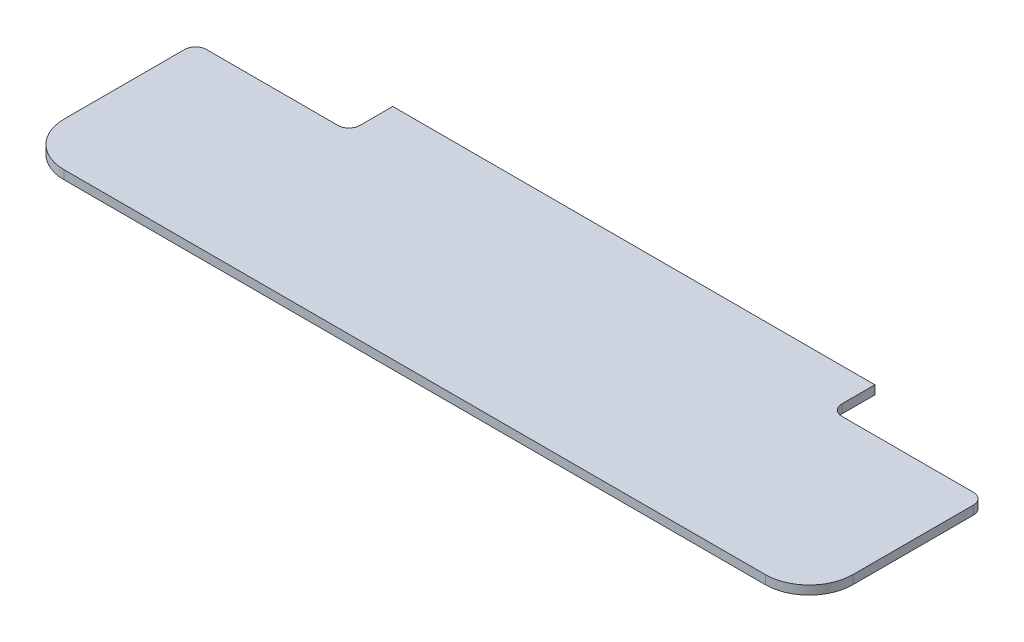
from build123d import *

# Parameters (mm, degrees)
SKETCH_1_W          = 360
SKETCH_1_H          = 100
EXTRUDE_1_DEPTH     = 4
FILLET_3_R          = 20
SKETCH_4_W          = 70
SKETCH_4_H          = 20
CUT_EXTRUDE_2_DEPTH = 6
FILLET_5_R          = 5


with BuildPart() as part:
    # 草图1 → 凸台-拉伸1 (new body)
    with BuildSketch(Plane(origin=(0, 0, 0), x_dir=(1, 0, 0), z_dir=(0, 1, 0))):
        Rectangle(SKETCH_1_W, SKETCH_1_H)
    extrude(amount=EXTRUDE_1_DEPTH)

    # 圆角3
    fillet_3_edges = [part.edges().sort_by_distance(p)[0] for p in [
        (-180, 2, 50),
        (180, 2, 50),
    ]]
    fillet(fillet_3_edges, radius=FILLET_3_R)

    # 草图4 → 切除-拉伸2 (cut)
    with BuildSketch(Plane(origin=(0, 4, 0), x_dir=(1, 0, 0), z_dir=(0, 1, 0))):
        with Locations((-145, 40)):
            Rectangle(SKETCH_4_W, SKETCH_4_H)
        with Locations((145, 40)):
            Rectangle(SKETCH_4_W, SKETCH_4_H)
    extrude(amount=-CUT_EXTRUDE_2_DEPTH, mode=Mode.SUBTRACT)

    # 圆角5
    fillet_5_edges = [part.edges().sort_by_distance(p)[0] for p in [
        (180, 2, -30),
        (110, 2, -30),
        (-110, 2, -30),
        (-180, 2, -30),
    ]]
    fillet(fillet_5_edges, radius=FILLET_5_R)


solid = part.part
